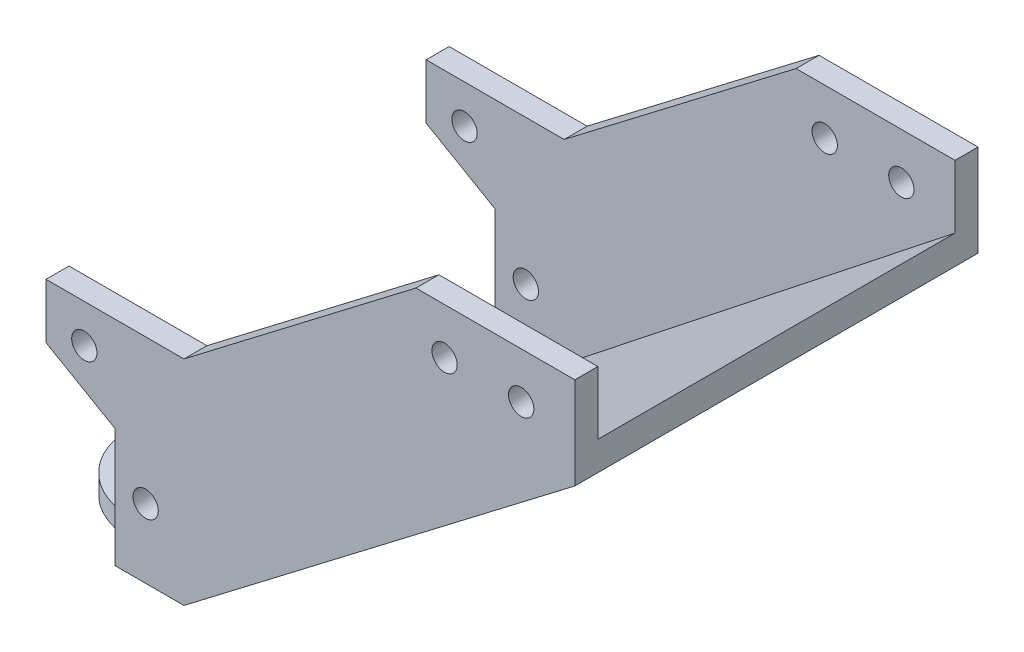
from build123d import *

# Parameters (mm, degrees)
SKETCH1_R                                      = 1.65
BOSS_EXTRUDE1_DEPTH                            = 3
SKETCH1_3_W                                    = 9
SKETCH1_3_H                                    = 2.5
BOSS_EXTRUDE2_DEPTH                            = 46.6
BOSS_EXTRUDE3_START                            = -49.6
SKETCH1_4_R                                    = 1.65
SKETCH1_4_W                                    = 9
SKETCH1_4_H                                    = 2.5
BOSS_EXTRUDE3_DEPTH                            = 3
CUT_EXTRUDE1_DEPTH                             = 88.5
SKETCH3_W                                      = 44.6
SKETCH3_H                                      = 2.5
BOSS_EXTRUDE4_DEPTH                            = 12
FILLET1_R                                      = 10
CSK_START                                      = -9
CSK_SLOT_FOR_M3_COUNTERSUNK_FLAT_HEAD_SC_DEPTH = 3


with BuildPart() as part:
    # Sketch1 → Boss-Extrude1 (new body)
    with BuildSketch(Plane.XY):
        Polygon((-13, 18.856406461), (-13, 11.696152423), (-4, 6.5), (-4, -9), (5, -9), (56, 30), (56, 42), (35.264699244, 42), (5, 18.856406461), align=None)
        Circle(SKETCH1_R, mode=Mode.SUBTRACT)
        with Locations((-8, 13.856406461)):
            Circle(SKETCH1_R, mode=Mode.SUBTRACT)
        with Locations((49, 36)):
            Circle(SKETCH1_R, mode=Mode.SUBTRACT)
        with Locations((39, 36)):
            Circle(SKETCH1_R, mode=Mode.SUBTRACT)
    extrude(amount=BOSS_EXTRUDE1_DEPTH)

    # Sketch1<3> → Boss-Extrude2 (add)
    with BuildSketch(Plane.XY):
        with Locations((0.5, -7.75)):
            Rectangle(SKETCH1_3_W, SKETCH1_3_H)
        Polygon((56, 33.77663551), (5, -6.5), (5, -9), (56, 30), align=None)
    extrude(amount=-BOSS_EXTRUDE2_DEPTH)

    # Sketch1<4> → Boss-Extrude3 (add)
    # profile 1 of 4: a face of its own
    with BuildSketch(Plane.XY.offset(BOSS_EXTRUDE3_START)):
        Polygon((5, 18.856406461), (-13, 18.856406461), (-13, 11.696152423), (-4, 6.5), (-4, -6.5), (5, -6.5), align=None)
        Circle(SKETCH1_4_R, mode=Mode.SUBTRACT)
        with Locations((-8, 13.856406461)):
            Circle(SKETCH1_4_R, mode=Mode.SUBTRACT)
    # profile 2 of 4: a face of its own
    with BuildSketch(Plane.XY.offset(BOSS_EXTRUDE3_START)):
        with Locations((0.5, -7.75)):
            Rectangle(SKETCH1_4_W, SKETCH1_4_H)
    # profile 3 of 4: a face of its own
    with BuildSketch(Plane.XY.offset(BOSS_EXTRUDE3_START)):
        Polygon((56, 33.77663551), (5, -6.5), (5, -9), (56, 30), align=None)
    # profile 4 of 4: a face of its own
    with BuildSketch(Plane.XY.offset(BOSS_EXTRUDE3_START)):
        Polygon((35.264699244, 42), (5, 18.856406461), (5, -6.5), (56, 33.77663551), (56, 42), align=None)
        with Locations((39, 36)):
            Circle(SKETCH1_4_R, mode=Mode.SUBTRACT)
        with Locations((49, 36)):
            Circle(SKETCH1_4_R, mode=Mode.SUBTRACT)
    extrude(amount=BOSS_EXTRUDE3_DEPTH)

    # Sketch2 → Cut-Extrude1 (cut)
    with BuildSketch(Plane.XZ.offset(9)):
        with BuildLine():
            Line((1, -24.95), (-1, -24.95))
            ThreePointArc((-1, -24.95), (-2.65, -23.3), (-1, -21.65))
            Line((-1, -21.65), (1, -21.65))
            ThreePointArc((1, -21.65), (2.65, -23.3), (1, -24.95))
        make_face()
    extrude(amount=-CUT_EXTRUDE1_DEPTH, mode=Mode.SUBTRACT)

    # Sketch3 → Boss-Extrude4 (add)
    with BuildSketch(Plane.ZY.offset(4)):
        with Locations((-23.3, -7.75)):
            Rectangle(SKETCH3_W, SKETCH3_H)
    extrude(amount=BOSS_EXTRUDE4_DEPTH)

    # Fillet1
    fillet1_edges = [part.edges().sort_by_distance(p)[0] for p in [
        (-16, -7.75, -45.6),
        (-16, -7.75, -1),
    ]]
    fillet(fillet1_edges, radius=FILLET1_R)

    # CSK SLOT for M3 Countersunk Flat Head Screw1: read off the stored shape, not the designer's step
    # CSK SLOT for M3 Countersunk Flat Hea 2 → CSK SLOT for M3 Countersunk Flat Head Screw1 (cut)
    with BuildSketch(Plane(origin=(0, 0, 0), x_dir=(1, 0, 0), z_dir=(0, 1, 0)).offset(CSK_START)):
        with BuildLine():
            ThreePointArc((1.7125, 24.788235112), (1.229705955, 25.020294045), (0.7, 25.1))
            Line((0.7, 25.1), (-0.7, 25.1))
            ThreePointArc((-0.7, 25.1), (-1.229705955, 25.020294045), (-1.7125, 24.788235112))
            ThreePointArc((-1.7125, 24.788235112), (-1.365316345, 24.909050642), (-1, 24.95))
            Line((-1, 24.95), (1, 24.95))
            ThreePointArc((1, 24.95), (1.365316345, 24.909050642), (1.7125, 24.788235112))
        make_face()
        with BuildLine():
            ThreePointArc((0.7, 21.5), (1.229705955, 21.579705955), (1.7125, 21.811764888))
            ThreePointArc((1.7125, 21.811764888), (1.365316345, 21.690949358), (1, 21.65))
            Line((1, 21.65), (-1, 21.65))
            ThreePointArc((-1, 21.65), (-1.365316345, 21.690949358), (-1.7125, 21.811764888))
            ThreePointArc((-1.7125, 21.811764888), (-1.229705955, 21.579705955), (-0.7, 21.5))
            Line((-0.7, 21.5), (0.7, 21.5))
        make_face()
    extrude(amount=CSK_SLOT_FOR_M3_COUNTERSUNK_FLAT_HEAD_SC_DEPTH, mode=Mode.SUBTRACT)

    # CSK SLOT for M3 Countersunk Flat Hea 3: loft between two sections, ruled curve by curve
    csk_slot_for_m3_countersunk_flat_hea_3_from = [
        Edge.make_three_point_arc((0.7, -7.649999999, -25.099999999), (1.972792205, -7.649999999, -24.572792205), (2.499999999, -7.649999999, -23.3)),
        Edge.make_three_point_arc((2.499999999, -7.649999999, -23.3), (1.972792205, -7.649999999, -22.027207795), (0.7, -7.649999999, -21.500000001)),
        Edge.make_three_point_arc((-0.7, -7.649999999, -21.500000001), (-1.972792205, -7.649999999, -22.027207795), (-2.499999999, -7.649999999, -23.3)),
        Edge.make_three_point_arc((-2.499999999, -7.649999999, -23.3), (-1.972792205, -7.649999999, -24.572792205), (-0.7, -7.649999999, -25.099999999)),
        Edge.make_line((0.7, -7.649999999, -21.500000001), (-0.7, -7.649999999, -21.500000001)),
        Edge.make_line((0.7, -7.649999999, -25.099999999), (-0.7, -7.649999999, -25.099999999)),
    ]
    csk_slot_for_m3_countersunk_flat_hea_3_to = [
        Edge.make_three_point_arc((0.7, -9, -26.45), (2.927386361, -9, -25.527386361), (3.85, -9, -23.3)),
        Edge.make_three_point_arc((3.85, -9, -23.3), (2.927386361, -9, -21.072613639), (0.7, -9, -20.15)),
        Edge.make_three_point_arc((-0.7, -9, -20.15), (-2.927386361, -9, -21.072613639), (-3.85, -9, -23.3)),
        Edge.make_three_point_arc((-3.85, -9, -23.3), (-2.927386361, -9, -25.527386361), (-0.7, -9, -26.45)),
        Edge.make_line((0.7, -9, -20.15), (-0.7, -9, -20.15)),
        Edge.make_line((0.7, -9, -26.45), (-0.7, -9, -26.45)),
    ]
    csk_slot_for_m3_countersunk_flat_hea_3 = Solid(Shell([*[Face.make_surface_from_curves(csk_slot_for_m3_countersunk_flat_hea_3_from[k], csk_slot_for_m3_countersunk_flat_hea_3_to[k]) for k in range(6)], Face(Wire(csk_slot_for_m3_countersunk_flat_hea_3_from)), Face(Wire(csk_slot_for_m3_countersunk_flat_hea_3_to))]))
    add(csk_slot_for_m3_countersunk_flat_hea_3, mode=Mode.SUBTRACT)


solid = part.part
